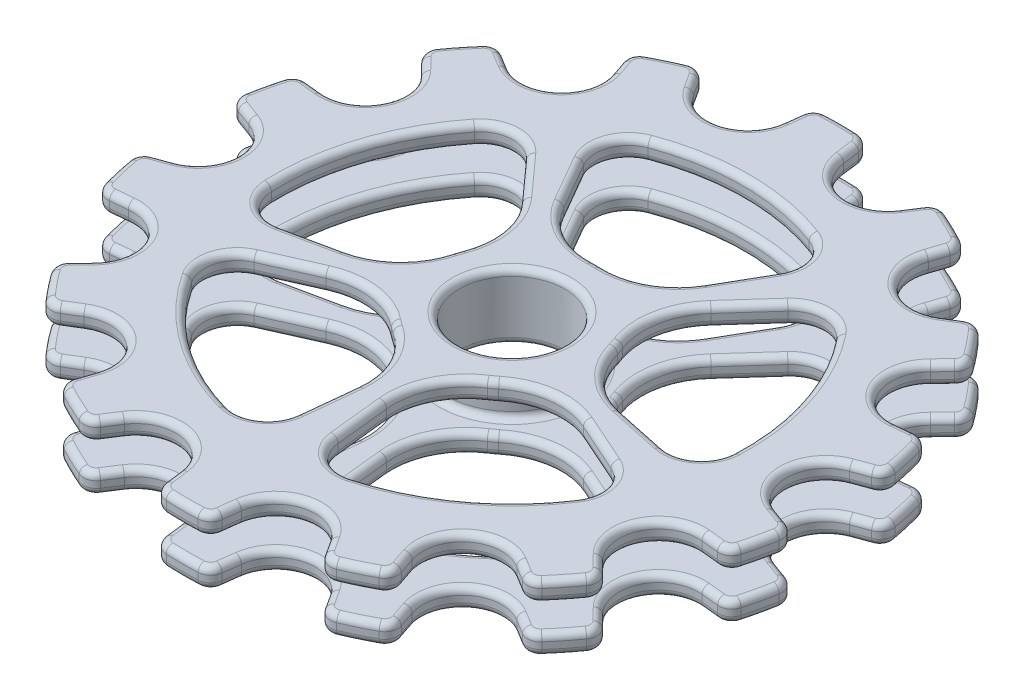
from build123d import *

# Parameters (mm, degrees)
SKETCH_1_W                       = 50
SKETCH_1_H                       = 10
CUT_REVOLVE_START                = -5
CUT_REVOLVE_1_DEPTH              = 10
FILLET_1_R                       = 2
FILLET_2_R                       = 6
PATTERN_CIRCULAR_1_COUNT         = 14
FILLET_1_OF_PATTERN_CIRCULAR_1_R = 2
FILLET_2_OF_PATTERN_CIRCULAR_1_R = 6
CUT_REVOLVE_3_DEPTH              = 10
FILLET_5_R                       = 11
FILLET_6_R                       = 5
PATTERN_CIRCULAR_3_COUNT         = 5
FILLET_5_OF_PATTERN_CIRCULAR_3_R = 11
FILLET_6_OF_PATTERN_CIRCULAR_3_R = 5
SKETCH_7_W                       = 8
SKETCH_7_H                       = 20
SKETCH_8_W                       = 65
SKETCH_8_H                       = 4
FILLET_7_R                       = 1


# Read off the part's stored shape, not the designer's step: Вырез-Повернуть1, Вырез-Повернуть3
with BuildPart() as part:
    # Эскиз1 → Повернуть1 (revolve)
    with BuildSketch(Plane.XY, mode=Mode.PRIVATE) as revolve_1_sk:
        with Locations((25, 0)):
            Rectangle(SKETCH_1_W, SKETCH_1_H)
    revolve(revolve_1_sk.sketch.rotate(Axis((0, -5, 0), (0, 1, 0)), 90), axis=Axis((0, -5, 0), (0, 1, 0)))

    # Вырез-Повернуть1 outline → Вырез-Повернуть1 (cut)
    with BuildSketch(Plane(origin=(0, 0, 0), x_dir=(1, 0, 0), z_dir=(0, 1, 0)).offset(CUT_REVOLVE_START)):
        with BuildLine():
            Line((-49.494015302, -7.095241316), (-30, 0))
            Line((-30, 0), (-49.494015302, 7.095241316))
            ThreePointArc((-49.494015302, 7.095241316), (-50, 0), (-49.494015302, -7.095241316))
        make_face()
    cut_revolve_1 = extrude(amount=CUT_REVOLVE_1_DEPTH, mode=Mode.SUBTRACT)

    # Скругление1
    fillet_1_edges = [part.edges().sort_by_distance(p)[0] for p in [
        (-49.494015302, 0, -7.095241316),
        (-49.494015302, 0, 7.095241316),
    ]]
    fillet(fillet_1_edges, radius=FILLET_1_R)

    # Скругление2
    fillet_2_edges = [part.edges().sort_by_distance(p)[0] for p in [
        (-30, 0, 0),
    ]]
    fillet(fillet_2_edges, radius=FILLET_2_R)

    # Круговой массив1: Вырез-Повернуть1 ×14 about axis
    pattern_circular_1_axis = Axis((0, 0, 0), (0, 1, 0))
    for i in range(1, PATTERN_CIRCULAR_1_COUNT):
        add(cut_revolve_1.rotate(pattern_circular_1_axis, i * 360 / PATTERN_CIRCULAR_1_COUNT), mode=Mode.SUBTRACT)

    # Скругление1 of Круговой массив1
    fillet_1_of_pattern_circular_1_edges = [part.edges().sort_by_distance(p)[0] for p in [
        (-47.671076767, 0, 15.082056887),
        (-41.514057102, 0, 27.867239959),
        (-36.40629683, 0, 34.272168755),
        (-25.311730757, 0, 43.119789959),
        (-17.930803313, 0, 46.67425728),
        (-4.096105708, 0, 49.831936728),
        (4.096105708, 0, 49.831936728),
        (17.930803313, 0, 46.67425728),
        (25.311730757, 0, 43.119789959),
        (36.40629683, 0, 34.272168755),
        (41.514057102, 0, 27.867239959),
        (47.671076767, 0, 15.082056887),
        (49.494015302, 0, 7.095241316),
        (49.494015302, 0, -7.095241316),
        (47.671076767, 0, -15.082056887),
        (41.514057102, 0, -27.867239959),
        (36.40629683, 0, -34.272168755),
        (25.311730757, 0, -43.119789959),
        (17.930803313, 0, -46.67425728),
        (4.096105708, 0, -49.831936728),
        (-4.096105708, 0, -49.831936728),
        (-17.930803313, 0, -46.67425728),
        (-25.311730757, 0, -43.119789959),
        (-36.40629683, 0, -34.272168755),
        (-41.514057102, 0, -27.867239959),
        (-47.671076767, 0, -15.082056887),
    ]]
    fillet(fillet_1_of_pattern_circular_1_edges, radius=FILLET_1_OF_PATTERN_CIRCULAR_1_R)

    # Скругление2 of Круговой массив1
    fillet_2_of_pattern_circular_1_edges = [part.edges().sort_by_distance(p)[0] for p in [
        (-27.029066037, 0, 13.016512174),
        (-18.704694056, 0, 23.454944474),
        (-6.675628019, 0, 29.247837365),
        (6.675628019, 0, 29.247837365),
        (18.704694056, 0, 23.454944474),
        (27.029066037, 0, 13.016512174),
        (30, 0, 0),
        (27.029066037, 0, -13.016512174),
        (18.704694056, 0, -23.454944474),
        (6.675628019, 0, -29.247837365),
        (-6.675628019, 0, -29.247837365),
        (-18.704694056, 0, -23.454944474),
        (-27.029066037, 0, -13.016512174),
    ]]
    fillet(fillet_2_of_pattern_circular_1_edges, radius=FILLET_2_OF_PATTERN_CIRCULAR_1_R)

    # Вырез-Повернуть3 outline → Вырез-Повернуть3 (cut)
    with BuildSketch(Plane(origin=(0, 0, 0), x_dir=(1, 0, 0), z_dir=(0, 1, 0)).offset(CUT_REVOLVE_START)):
        with BuildLine():
            ThreePointArc((-6.5, 11.258330249), (0, 13), (6.5, 11.258330249))
            Line((6.5, 11.258330249), (17.5, 30.310889132))
            ThreePointArc((17.5, 30.310889132), (0, 35), (-17.5, 30.310889132))
            Line((-17.5, 30.310889132), (-6.5, 11.258330249))
        make_face()
    cut_revolve_3 = extrude(amount=CUT_REVOLVE_3_DEPTH, mode=Mode.SUBTRACT)

    # Скругление5
    fillet_5_edges = [part.edges().sort_by_distance(p)[0] for p in [
        (-6.5, 0, -11.258330249),
        (6.5, 0, -11.258330249),
    ]]
    fillet(fillet_5_edges, radius=FILLET_5_R)

    # Скругление6
    fillet_6_edges = [part.edges().sort_by_distance(p)[0] for p in [
        (-17.5, 0, -30.310889132),
        (17.5, 0, -30.310889132),
    ]]
    fillet(fillet_6_edges, radius=FILLET_6_R)

    # Круговой массив3: Вырез-Повернуть3 ×5 about axis
    pattern_circular_3_axis = Axis((0, 0, 0), (0, 1, 0))
    for i in range(1, PATTERN_CIRCULAR_3_COUNT):
        add(cut_revolve_3.rotate(pattern_circular_3_axis, i * 360 / PATTERN_CIRCULAR_3_COUNT), mode=Mode.SUBTRACT)

    # Скругление5 of Круговой массив3
    fillet_5_of_pattern_circular_3_edges = [part.edges().sort_by_distance(p)[0] for p in [
        (-12.715918809, 0, 2.702851981),
        (-8.698697882, 0, -9.660882731),
        (-1.358870022, 0, 12.92878464),
        (-11.876090949, 0, 5.28757636),
        (11.876090949, 0, 5.28757636),
        (1.358870022, 0, 12.92878464),
        (8.698697882, 0, -9.660882731),
        (12.715918809, 0, 2.702851981),
    ]]
    fillet(fillet_5_of_pattern_circular_3_edges, radius=FILLET_5_OF_PATTERN_CIRCULAR_3_R)

    # Скругление6 of Круговой массив3
    fillet_6_of_pattern_circular_3_edges = [part.edges().sort_by_distance(p)[0] for p in [
        (-34.235166025, 0, 7.276909179),
        (-23.419571222, 0, -26.010068892),
        (-3.658496214, 0, 34.808266338),
        (-31.974091017, 0, 14.235782507),
        (31.974091017, 0, 14.235782507),
        (3.658496214, 0, 34.808266338),
        (23.419571222, 0, -26.010068892),
        (34.235166025, 0, 7.276909179),
    ]]
    fillet(fillet_6_of_pattern_circular_3_edges, radius=FILLET_6_OF_PATTERN_CIRCULAR_3_R)

    # Эскиз7 → Вырез-Повернуть4 (revolve, cut)
    with BuildSketch(Plane(origin=(0, 0, 0), x_dir=(0, 0, -1), z_dir=(1, 0, 0)), mode=Mode.PRIVATE) as cut_revolve_4_sk:
        with Locations((4, 0)):
            Rectangle(SKETCH_7_W, SKETCH_7_H)
    revolve(cut_revolve_4_sk.sketch.rotate(Axis((0, 10, 0), (0, -1, 0)), 180), axis=Axis((0, 10, 0), (0, -1, 0)), mode=Mode.SUBTRACT)

    # Эскиз8 → Вырез-Повернуть5 (revolve, cut)
    with BuildSketch(Plane(origin=(0, 0, 0), x_dir=(0, 0, -1), z_dir=(1, 0, 0)), mode=Mode.PRIVATE) as cut_revolve_5_sk:
        with Locations((42.5, 0)):
            Rectangle(SKETCH_8_W, SKETCH_8_H)
    revolve(cut_revolve_5_sk.sketch.rotate(Axis((0, -5, 0), (0, -1, 0)), 180), axis=Axis((0, -5, 0), (0, -1, 0)), mode=Mode.SUBTRACT)

    # Скругление7
    fillet_7_edges = [part.edges().sort_by_distance(p)[0] for p in [
        (-44.729636321, -5, -14.787721377),
        (-39.449978213, -5, -25.751044404),
        (-39.091574123, -5, -31.174490093),
        (-40.923342092, -5, -27.933193683),
        (-47.35433668, -5, -14.579095821),
        (-39.091574123, 5, -31.174490093),
        (-40.923342092, 5, -27.933193683),
        (-47.35433668, 5, -14.579095821),
        (-48.746395609, 5, -11.126046698),
        (-33.883857954, -5, -32.730738444),
        (-24.370242777, -5, -40.317593379),
        (-21.694186956, -5, -45.048443395),
        (-24.750898675, -5, -42.922910573),
        (-36.339150501, -5, -33.681588119),
        (-48.746395609, -5, -11.126046698),
        (-21.694186956, 5, -45.048443395),
        (-24.750898675, 5, -42.922910573),
        (-36.339150501, 5, -33.681588119),
        (-16.326965961, -5, -44.191031346),
        (-4.463681878, -5, -46.898748523),
        (0, -5, -50),
        (-3.676236225, -5, -49.41121861),
        (-18.126549895, -5, -46.113028812),
        (0, 5, -50),
        (-3.676236225, 5, -49.41121861),
        (-18.126549895, 5, -46.113028812),
        (-46.716161642, -5, 6.084185269),
        (-46.716161642, -5, -6.084185269),
        (-48.990415716, -5, -7.410965205),
        (4.463681878, -5, -46.898748523),
        (16.326965961, -5, -44.191031346),
        (21.694186956, -5, -45.048443395),
        (18.126549895, -5, -46.113028812),
        (3.676236225, -5, -49.41121861),
        (21.694186956, 5, -45.048443395),
        (18.126549895, 5, -46.113028812),
        (3.676236225, 5, -49.41121861),
        (-48.990415716, -5, 7.410965205),
        (24.370242777, -5, -40.317593379),
        (33.883857954, -5, -32.730738444),
        (39.091574123, -5, -31.174490093),
        (36.339150501, -5, -33.681588119),
        (24.750898675, -5, -42.922910573),
        (39.091574123, 5, -31.174490093),
        (36.339150501, 5, -33.681588119),
        (24.750898675, 5, -42.922910573),
        (-48.990415716, 5, -7.410965205),
        (39.449978213, -5, -25.751044404),
        (44.729636321, -5, -14.787721377),
        (48.746395609, -5, -11.126046698),
        (47.35433668, -5, -14.579095821),
        (-48.990415716, 5, 7.410965205),
        (40.923342092, -5, -27.933193683),
        (48.746395609, 5, -11.126046698),
        (47.35433668, 5, -14.579095821),
        (40.923342092, 5, -27.933193683),
        (46.716161642, -5, -6.084185269),
        (46.716161642, -5, 6.084185269),
        (48.746395609, -5, 11.126046698),
        (48.990415716, -5, 7.410965205),
        (48.990415716, -5, -7.410965205),
        (48.746395609, 5, 11.126046698),
        (48.990415716, 5, 7.410965205),
        (48.990415716, 5, -7.410965205),
        (44.729636321, -5, 14.787721377),
        (39.449978213, -5, 25.751044404),
        (39.091574123, -5, 31.174490093),
        (40.923342092, -5, 27.933193683),
        (47.35433668, -5, 14.579095821),
        (39.091574123, 5, 31.174490093),
        (40.923342092, 5, 27.933193683),
        (47.35433668, 5, 14.579095821),
        (33.883857954, -5, 32.730738444),
        (24.370242777, -5, 40.317593379),
        (21.694186956, -5, 45.048443395),
        (24.750898675, -5, 42.922910573),
        (36.339150501, -5, 33.681588119),
        (21.694186956, 5, 45.048443395),
        (24.750898675, 5, 42.922910573),
        (36.339150501, 5, 33.681588119),
        (16.326965961, -5, 44.191031346),
        (4.463681878, -5, 46.898748523),
        (0, -5, 50),
        (3.676236225, -5, 49.41121861),
        (18.126549895, -5, 46.113028812),
        (0, 5, 50),
        (3.676236225, 5, 49.41121861),
        (18.126549895, 5, 46.113028812),
        (-4.463681878, -5, 46.898748523),
        (-16.326965961, -5, 44.191031346),
        (-21.694186956, -5, 45.048443395),
        (-18.126549895, -5, 46.113028812),
        (-3.676236225, -5, 49.41121861),
        (-21.694186956, 5, 45.048443395),
        (-18.126549895, 5, 46.113028812),
        (-3.676236225, 5, 49.41121861),
        (-24.370242777, -5, 40.317593379),
        (-33.883857954, -5, 32.730738444),
        (-39.091574123, -5, 31.174490093),
        (-36.339150501, -5, 33.681588119),
        (-46.716161642, 5, -6.084185269),
        (-24.750898675, -5, 42.922910573),
        (-39.091574123, 5, 31.174490093),
        (-36.339150501, 5, 33.681588119),
        (-24.750898675, 5, 42.922910573),
        (-39.449978213, -5, 25.751044404),
        (-44.729636321, -5, 14.787721377),
        (-48.746395609, -5, 11.126046698),
        (-47.35433668, -5, 14.579095821),
        (-40.923342092, -5, 27.933193683),
        (-48.746395609, 5, 11.126046698),
        (-46.716161642, 5, 6.084185269),
        (-47.35433668, 5, 14.579095821),
        (-40.923342092, 5, 27.933193683),
        (-41.542826402, 5, 0),
        (-39.449978213, 5, -25.751044404),
        (-44.729636321, 5, -14.787721377),
        (-37.428793272, 5, -18.024756853),
        (-37.428793272, -5, -18.024756853),
        (-41.542826402, -5, 0),
        (-24.370242777, 5, -40.317593379),
        (-33.883857954, 5, -32.730738444),
        (-25.901528602, 5, -32.479489551),
        (-25.901528602, -5, -32.479489551),
        (-4.463681878, 5, -46.898748523),
        (-16.326965961, 5, -44.191031346),
        (-9.24414853, 5, -40.50126101),
        (-9.24414853, -5, -40.50126101),
        (16.326965961, 5, -44.191031346),
        (4.463681878, 5, -46.898748523),
        (9.24414853, 5, -40.50126101),
        (9.24414853, -5, -40.50126101),
        (33.883857954, 5, -32.730738444),
        (24.370242777, 5, -40.317593379),
        (25.901528602, 5, -32.479489551),
        (25.901528602, -5, -32.479489551),
        (44.729636321, 5, -14.787721377),
        (39.449978213, 5, -25.751044404),
        (37.428793272, 5, -18.024756853),
        (37.428793272, -5, -18.024756853),
        (46.716161642, 5, 6.084185269),
        (46.716161642, 5, -6.084185269),
        (41.542826402, 5, 0),
        (41.542826402, -5, 0),
        (39.449978213, 5, 25.751044404),
        (44.729636321, 5, 14.787721377),
        (37.428793272, 5, 18.024756853),
        (37.428793272, -5, 18.024756853),
        (24.370242777, 5, 40.317593379),
        (33.883857954, 5, 32.730738444),
        (25.901528602, 5, 32.479489551),
        (25.901528602, -5, 32.479489551),
        (4.463681878, 5, 46.898748523),
        (16.326965961, 5, 44.191031346),
        (9.24414853, 5, 40.50126101),
        (9.24414853, -5, 40.50126101),
        (-16.326965961, 5, 44.191031346),
        (-4.463681878, 5, 46.898748523),
        (-9.24414853, 5, 40.50126101),
        (-9.24414853, -5, 40.50126101),
        (-33.883857954, 5, 32.730738444),
        (-24.370242777, 5, 40.317593379),
        (-25.901528602, 5, 32.479489551),
        (-25.901528602, -5, 32.479489551),
        (-44.729636321, 5, 14.787721377),
        (-39.449978213, 5, 25.751044404),
        (-37.428793272, 5, 18.024756853),
        (-37.428793272, -5, 18.024756853),
        (0, -5, -13),
        (0, 5, -13),
        (12.727781981, -5, -22.045165058),
        (-12.727781981, -5, -22.045165058),
        (6.411404015, -5, -14.318801097),
        (6.411404015, 5, -14.318801097),
        (-6.411404015, -5, -14.318801097),
        (-6.411404015, 5, -14.318801097),
        (0, 5, -35),
        (0, -5, -35),
        (12.727781981, 5, -22.045165058),
        (-12.727781981, 5, -22.045165058),
        (15.16456395, 5, -29.810822992),
        (15.16456395, -5, -29.810822992),
        (-15.16456395, 5, -29.810822992),
        (-15.16456395, -5, -29.810822992),
        (12.363734712, -5, -4.017220927),
        (12.363734712, 5, -4.017220927),
        (24.899298814, -5, 5.292509344),
        (17.033096949, -5, -18.917170638),
        (15.599221887, -5, 1.672854689),
        (15.599221887, 5, 1.672854689),
        (11.63675629, -5, -10.522360445),
        (11.63675629, 5, -10.522360445),
        (7.64120828, -5, 10.517220927),
        (7.64120828, 5, 10.517220927),
        (2.660830982, -5, 25.316115719),
        (23.254814829, -5, 10.353710633),
        (3.22944531, -5, 15.352682153),
        (3.22944531, 5, 15.352682153),
        (13.603314921, -5, 7.8156247),
        (13.603314921, 5, 7.8156247),
        (-7.64120828, -5, 10.517220927),
        (-7.64120828, 5, 10.517220927),
        (-23.254814829, -5, 10.353710633),
        (-2.660830982, -5, 25.316115719),
        (-13.603314921, -5, 7.8156247),
        (-13.603314921, 5, 7.8156247),
        (-3.22944531, -5, 15.352682153),
        (-3.22944531, 5, 15.352682153),
        (-12.363734712, -5, -4.017220927),
        (-12.363734712, 5, -4.017220927),
        (-17.033096949, -5, -18.917170638),
        (-24.899298814, -5, 5.292509344),
        (-11.63675629, -5, -10.522360445),
        (-11.63675629, 5, -10.522360445),
        (-15.599221887, -5, 1.672854689),
        (-15.599221887, 5, 1.672854689),
        (33.28697807, 5, -10.815594803),
        (33.28697807, -5, -10.815594803),
        (24.899298814, 5, 5.292509344),
        (17.033096949, 5, -18.917170638),
        (33.037885436, 5, 5.210306441),
        (33.037885436, -5, 5.210306441),
        (23.66566949, 5, -23.634408283),
        (23.66566949, -5, -23.634408283),
        (20.57248383, 5, 28.315594803),
        (20.57248383, -5, 28.315594803),
        (2.660830982, 5, 25.316115719),
        (23.254814829, 5, 10.353710633),
        (5.253972166, 5, 33.030969465),
        (5.253972166, -5, 33.030969465),
        (29.790752062, 5, 15.20395537),
        (29.790752062, -5, 15.20395537),
        (-20.57248383, 5, 28.315594803),
        (-20.57248383, -5, 28.315594803),
        (-23.254814829, 5, 10.353710633),
        (-2.660830982, 5, 25.316115719),
        (-29.790752062, 5, 15.20395537),
        (-29.790752062, -5, 15.20395537),
        (-5.253972166, 5, 33.030969465),
        (-5.253972166, -5, 33.030969465),
        (-33.28697807, 5, -10.815594803),
        (-33.28697807, -5, -10.815594803),
        (-17.033096949, 5, -18.917170638),
        (-24.899298814, 5, 5.292509344),
        (-23.66566949, 5, -23.634408283),
        (-23.66566949, -5, -23.634408283),
        (-33.037885436, 5, 5.210306441),
        (-33.037885436, -5, 5.210306441),
        (0, -5, -8),
        (0, 5, -8),
        (-33.037885436, 2, 5.210306441),
        (-33.037885436, -2, 5.210306441),
        (0, -2, -35),
        (-12.727781981, -2, -22.045165058),
        (0, -2, -13),
        (20.57248383, -2, 28.315594803),
        (23.254814829, -2, 10.353710633),
        (7.64120828, -2, 10.517220927),
        (-33.28697807, -2, -10.815594803),
        (-24.899298814, -2, 5.292509344),
        (-12.363734712, -2, -4.017220927),
        (0, -2, -10),
        (-20.57248383, -2, 28.315594803),
        (-2.660830982, -2, 25.316115719),
        (-7.64120828, -2, 10.517220927),
        (33.28697807, -2, -10.815594803),
        (17.033096949, -2, -18.917170638),
        (12.363734712, -2, -4.017220927),
        (47.35433668, -2, -14.579095821),
        (48.746395609, -2, -11.126046698),
        (48.990415716, -2, -7.410965205),
        (46.716161642, -2, -6.084185269),
        (48.990415716, -2, 7.410965205),
        (48.746395609, -2, 11.126046698),
        (47.35433668, -2, 14.579095821),
        (44.729636321, -2, 14.787721377),
        (40.923342092, -2, 27.933193683),
        (39.091574123, -2, 31.174490093),
        (36.339150501, -2, 33.681588119),
        (33.883857954, -2, 32.730738444),
        (24.750898675, -2, 42.922910573),
        (21.694186956, -2, 45.048443395),
        (18.126549895, -2, 46.113028812),
        (16.326965961, -2, 44.191031346),
        (3.676236225, -2, 49.41121861),
        (0, -2, 50),
        (-3.676236225, -2, 49.41121861),
        (-4.463681878, -2, 46.898748523),
        (-18.126549895, -2, 46.113028812),
        (-21.694186956, -2, 45.048443395),
        (-24.750898675, -2, 42.922910573),
        (-24.370242777, -2, 40.317593379),
        (-36.339150501, -2, 33.681588119),
        (-39.091574123, -2, 31.174490093),
        (-40.923342092, -2, 27.933193683),
        (-39.449978213, -2, 25.751044404),
        (-47.35433668, -2, 14.579095821),
        (-48.746395609, -2, 11.126046698),
        (-48.990415716, -2, 7.410965205),
        (-46.716161642, -2, 6.084185269),
        (-48.990415716, -2, -7.410965205),
        (-48.746395609, -2, -11.126046698),
        (-47.35433668, -2, -14.579095821),
        (-44.729636321, -2, -14.787721377),
        (-40.923342092, -2, -27.933193683),
        (-39.091574123, -2, -31.174490093),
        (-36.339150501, -2, -33.681588119),
        (-33.883857954, -2, -32.730738444),
        (-24.750898675, -2, -42.922910573),
        (-21.694186956, -2, -45.048443395),
        (-18.126549895, -2, -46.113028812),
        (-16.326965961, -2, -44.191031346),
        (-3.676236225, -2, -49.41121861),
        (0, -2, -50),
        (3.676236225, -2, -49.41121861),
        (4.463681878, -2, -46.898748523),
        (18.126549895, -2, -46.113028812),
        (21.694186956, -2, -45.048443395),
        (24.750898675, -2, -42.922910573),
        (24.370242777, -2, -40.317593379),
        (36.339150501, -2, -33.681588119),
        (39.091574123, -2, -31.174490093),
        (40.923342092, -2, -27.933193683),
        (39.449978213, -2, -25.751044404),
        (44.729636321, -2, -14.787721377),
        (37.428793272, -2, -18.024756853),
        (33.883857954, -2, -32.730738444),
        (25.901528602, -2, -32.479489551),
        (16.326965961, -2, -44.191031346),
        (9.24414853, -2, -40.50126101),
        (-4.463681878, -2, -46.898748523),
        (-9.24414853, -2, -40.50126101),
        (-24.370242777, -2, -40.317593379),
        (-25.901528602, -2, -32.479489551),
        (-39.449978213, -2, -25.751044404),
        (-37.428793272, -2, -18.024756853),
        (-46.716161642, -2, -6.084185269),
        (-41.542826402, -2, 0),
        (-44.729636321, -2, 14.787721377),
        (-37.428793272, -2, 18.024756853),
        (-33.883857954, -2, 32.730738444),
        (-25.901528602, -2, 32.479489551),
        (-16.326965961, -2, 44.191031346),
        (-9.24414853, -2, 40.50126101),
        (4.463681878, -2, 46.898748523),
        (9.24414853, -2, 40.50126101),
        (24.370242777, -2, 40.317593379),
        (25.901528602, -2, 32.479489551),
        (39.449978213, -2, 25.751044404),
        (37.428793272, -2, 18.024756853),
        (46.716161642, -2, 6.084185269),
        (41.542826402, -2, 0),
        (12.727781981, -2, -22.045165058),
        (6.411404015, -2, -14.318801097),
        (-6.411404015, -2, -14.318801097),
        (-15.16456395, -2, -29.810822992),
        (15.16456395, -2, -29.810822992),
        (24.899298814, -2, 5.292509344),
        (15.599221887, -2, 1.672854689),
        (11.63675629, -2, -10.522360445),
        (23.66566949, -2, -23.634408283),
        (33.037885436, -2, 5.210306441),
        (2.660830982, -2, 25.316115719),
        (3.22944531, -2, 15.352682153),
        (13.603314921, -2, 7.8156247),
        (29.790752062, -2, 15.20395537),
        (5.253972166, -2, 33.030969465),
        (-23.254814829, -2, 10.353710633),
        (-13.603314921, -2, 7.8156247),
        (-3.22944531, -2, 15.352682153),
        (-5.253972166, -2, 33.030969465),
        (-29.790752062, -2, 15.20395537),
        (0, 2, -13),
        (-12.727781981, 2, -22.045165058),
        (0, 2, -35),
        (7.64120828, 2, 10.517220927),
        (23.254814829, 2, 10.353710633),
        (20.57248383, 2, 28.315594803),
        (-12.363734712, 2, -4.017220927),
        (-24.899298814, 2, 5.292509344),
        (-33.28697807, 2, -10.815594803),
        (-7.64120828, 2, 10.517220927),
        (-2.660830982, 2, 25.316115719),
        (-20.57248383, 2, 28.315594803),
        (12.363734712, 2, -4.017220927),
        (17.033096949, 2, -18.917170638),
        (33.28697807, 2, -10.815594803),
        (39.449978213, 2, -25.751044404),
        (40.923342092, 2, -27.933193683),
        (39.091574123, 2, -31.174490093),
        (36.339150501, 2, -33.681588119),
        (24.370242777, 2, -40.317593379),
        (24.750898675, 2, -42.922910573),
        (21.694186956, 2, -45.048443395),
        (18.126549895, 2, -46.113028812),
        (4.463681878, 2, -46.898748523),
        (3.676236225, 2, -49.41121861),
        (0, 2, -50),
        (-3.676236225, 2, -49.41121861),
        (-16.326965961, 2, -44.191031346),
        (-18.126549895, 2, -46.113028812),
        (-21.694186956, 2, -45.048443395),
        (-24.750898675, 2, -42.922910573),
        (-33.883857954, 2, -32.730738444),
        (-36.339150501, 2, -33.681588119),
        (-39.091574123, 2, -31.174490093),
        (-40.923342092, 2, -27.933193683),
        (-44.729636321, 2, -14.787721377),
        (-47.35433668, 2, -14.579095821),
        (-48.746395609, 2, -11.126046698),
        (-48.990415716, 2, -7.410965205),
        (-46.716161642, 2, 6.084185269),
        (-48.990415716, 2, 7.410965205),
        (-48.746395609, 2, 11.126046698),
        (-47.35433668, 2, 14.579095821),
        (-39.449978213, 2, 25.751044404),
        (-40.923342092, 2, 27.933193683),
        (-39.091574123, 2, 31.174490093),
        (-36.339150501, 2, 33.681588119),
        (-24.370242777, 2, 40.317593379),
        (-24.750898675, 2, 42.922910573),
        (-21.694186956, 2, 45.048443395),
        (-18.126549895, 2, 46.113028812),
        (-4.463681878, 2, 46.898748523),
        (-3.676236225, 2, 49.41121861),
        (0, 2, 50),
        (3.676236225, 2, 49.41121861),
        (16.326965961, 2, 44.191031346),
        (18.126549895, 2, 46.113028812),
        (21.694186956, 2, 45.048443395),
        (24.750898675, 2, 42.922910573),
        (33.883857954, 2, 32.730738444),
        (36.339150501, 2, 33.681588119),
        (39.091574123, 2, 31.174490093),
        (40.923342092, 2, 27.933193683),
        (44.729636321, 2, 14.787721377),
        (47.35433668, 2, 14.579095821),
        (48.746395609, 2, 11.126046698),
        (48.990415716, 2, 7.410965205),
        (46.716161642, 2, -6.084185269),
        (48.990415716, 2, -7.410965205),
        (48.746395609, 2, -11.126046698),
        (47.35433668, 2, -14.579095821),
        (37.428793272, 2, -18.024756853),
        (44.729636321, 2, -14.787721377),
        (41.542826402, 2, 0),
        (46.716161642, 2, 6.084185269),
        (37.428793272, 2, 18.024756853),
        (39.449978213, 2, 25.751044404),
        (25.901528602, 2, 32.479489551),
        (24.370242777, 2, 40.317593379),
        (9.24414853, 2, 40.50126101),
        (4.463681878, 2, 46.898748523),
        (-9.24414853, 2, 40.50126101),
        (-16.326965961, 2, 44.191031346),
        (-25.901528602, 2, 32.479489551),
        (-33.883857954, 2, 32.730738444),
        (-37.428793272, 2, 18.024756853),
        (-44.729636321, 2, 14.787721377),
        (-41.542826402, 2, 0),
        (-46.716161642, 2, -6.084185269),
        (-37.428793272, 2, -18.024756853),
        (-39.449978213, 2, -25.751044404),
        (-25.901528602, 2, -32.479489551),
        (-24.370242777, 2, -40.317593379),
        (-9.24414853, 2, -40.50126101),
        (-4.463681878, 2, -46.898748523),
        (9.24414853, 2, -40.50126101),
        (16.326965961, 2, -44.191031346),
        (25.901528602, 2, -32.479489551),
        (33.883857954, 2, -32.730738444),
        (6.411404015, 2, -14.318801097),
        (12.727781981, 2, -22.045165058),
        (15.16456395, 2, -29.810822992),
        (-15.16456395, 2, -29.810822992),
        (-6.411404015, 2, -14.318801097),
        (15.599221887, 2, 1.672854689),
        (24.899298814, 2, 5.292509344),
        (33.037885436, 2, 5.210306441),
        (23.66566949, 2, -23.634408283),
        (11.63675629, 2, -10.522360445),
        (3.22944531, 2, 15.352682153),
        (2.660830982, 2, 25.316115719),
        (5.253972166, 2, 33.030969465),
        (29.790752062, 2, 15.20395537),
        (13.603314921, 2, 7.8156247),
        (-13.603314921, 2, 7.8156247),
        (-23.254814829, 2, 10.353710633),
        (-29.790752062, 2, 15.20395537),
        (-5.253972166, 2, 33.030969465),
        (-3.22944531, 2, 15.352682153),
        (0, 2, -10),
        (-17.033096949, -2, -18.917170638),
        (-11.63675629, -2, -10.522360445),
        (-15.599221887, -2, 1.672854689),
        (-23.66566949, -2, -23.634408283),
        (-11.63675629, 2, -10.522360445),
        (-17.033096949, 2, -18.917170638),
        (-23.66566949, 2, -23.634408283),
        (-15.599221887, 2, 1.672854689),
    ]]
    fillet(fillet_7_edges, radius=FILLET_7_R)


solid = part.part
